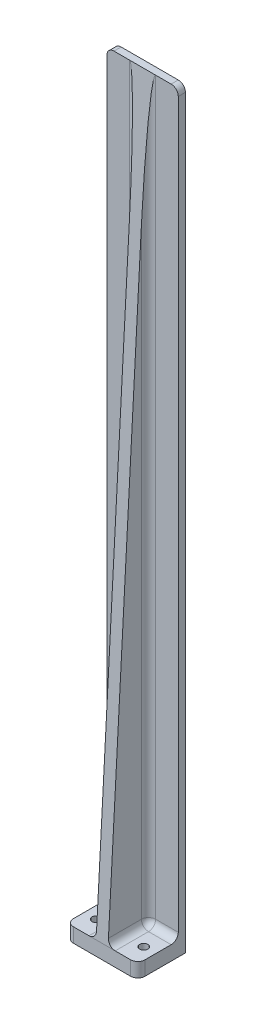
from build123d import *

# Parameters (mm, degrees)
SKETCH_1_W      = 30
SKETCH_1_H      = 20
SKETCH_1_R      = 1.75
EXTRUDE_1_DEPTH = 6
SKETCH_2_W      = 3
SKETCH_2_H      = 310
EXTRUDE_2_DEPTH = 30
EXTRUDE_3_DEPTH = 2.5
FILLET_1_R      = 3


with BuildPart() as part:
    # 草图1 → 凸台-拉伸1 (new body)
    with BuildSketch(Plane(origin=(0, 0, 0), x_dir=(1, 0, 0), z_dir=(0, 1, 0))):
        Rectangle(SKETCH_1_W, SKETCH_1_H)
        with Locations(Location((-10, -2.5, 0), (0, 0, 270))):
            Circle(SKETCH_1_R, mode=Mode.SUBTRACT)
        with Locations(Location((10, -2.5, 0), (0, 0, 90))):
            Circle(SKETCH_1_R, mode=Mode.SUBTRACT)
    extrude(amount=EXTRUDE_1_DEPTH)

    # 草图2 → 凸台-拉伸2 (add)
    with BuildSketch(Plane(origin=(15, 0, 0), x_dir=(0, 0, -1), z_dir=(1, 0, 0))):
        with Locations((8.5, 161)):
            Rectangle(SKETCH_2_W, SKETCH_2_H)
    extrude(amount=-EXTRUDE_2_DEPTH)

    # 草图3 → 凸台-拉伸3 (add, symmetric)
    with BuildSketch(Plane(origin=(0, 0, 0), x_dir=(0, 0, -1), z_dir=(1, 0, 0))):
        Polygon((7, 316), (-10, 6), (7, 6), align=None)
    extrude(amount=EXTRUDE_3_DEPTH, both=True)

    # 圆角1
    # the kernel refuses this fillet: 3 mm, written as the material it adds along each edge
    with BuildSketch(Plane(origin=(-5.5, 9, -4), x_dir=(0, -1, 0), z_dir=(0, 0, -1))) as fillet_1_piece_1_section:
        Polygon((0, 0), (FILLET_1_R, 0), (FILLET_1_R, -FILLET_1_R), (0, -FILLET_1_R), align=None)
    fillet_1_piece_1 = extrude(amount=FILLET_1_R, mode=Mode.PRIVATE)
    fillet_1_piece_1 = fillet_1_piece_1 - Plane(origin=(-5.5, 9, -4), x_dir=(-0.7071067811865475, 0.7071067811865475, 0), z_dir=(0, 0, -1)) * Sphere(FILLET_1_R, mode=Mode.PRIVATE)
    add(fillet_1_piece_1)
    with BuildSketch(Plane(origin=(5.5, 9, -4), x_dir=(0, -1, 0), z_dir=(0, 0, -1))) as fillet_1_piece_2_section:
        Polygon((0, 0), (FILLET_1_R, 0), (FILLET_1_R, FILLET_1_R), (0, FILLET_1_R), align=None)
    fillet_1_piece_2 = extrude(amount=FILLET_1_R, mode=Mode.PRIVATE)
    fillet_1_piece_2 = fillet_1_piece_2 - Plane(origin=(5.5, 9, -4), x_dir=(0.7071067811865475, 0.7071067811865475, 0), z_dir=(0, 0, -1)) * Sphere(FILLET_1_R, mode=Mode.PRIVATE)
    add(fillet_1_piece_2)
    with BuildSketch(Plane(origin=(-5.5, 6, -7), x_dir=(0, 0, 1), z_dir=(-1, 0, 0)), Plane(origin=(15, 6, -7), x_dir=(0, 0, 1), z_dir=(-1, 0, 0))) as fillet_1_piece_3:
        with BuildLine():
            CenterArc((FILLET_1_R, FILLET_1_R), FILLET_1_R, 180, 90)
            Line((0, FILLET_1_R), (0, 0))
            Line((0, 0), (FILLET_1_R, 0))
        make_face()
    extrude(amount=9.5)
    with BuildSketch(Plane(origin=(-2.5, 9, -7), x_dir=(-1, 0, 0), z_dir=(0, 1, 0))) as fillet_1_piece_4_section:
        with BuildLine():
            CenterArc((FILLET_1_R, FILLET_1_R), FILLET_1_R, 180, 90)
            Line((0, FILLET_1_R), (0, 0))
            Line((0, 0), (FILLET_1_R, 0))
        make_face()
    fillet_1_piece_4 = extrude(amount=307, mode=Mode.PRIVATE)
    fillet_1_piece_4 = split(fillet_1_piece_4, bisect_by=Plane(origin=(-3.194365112, 156.962181191, 1.721428773), z_dir=(0, -0.054756437403794746, -0.9984997408927277)), keep=Keep.TOP, mode=Mode.PRIVATE)
    add(fillet_1_piece_4)
    with BuildSketch(Plane(origin=(-2.5, 6, 10), x_dir=(-1, 0, 0), z_dir=(0, 0, -1))) as fillet_1_piece_5_section:
        with BuildLine():
            CenterArc((FILLET_1_R, FILLET_1_R), FILLET_1_R, 180, 90)
            Line((0, FILLET_1_R), (0, 0))
            Line((0, 0), (FILLET_1_R, 0))
        make_face()
    fillet_1_piece_5 = extrude(amount=14, mode=Mode.PRIVATE)
    fillet_1_piece_5 = split(fillet_1_piece_5, bisect_by=Plane(origin=(-3.180148424, 7.059257164, 9.941911704), z_dir=(0, -0.054756437403794746, -0.9984997408927277)), keep=Keep.TOP, mode=Mode.PRIVATE)
    add(fillet_1_piece_5)
    with BuildSketch(Plane(origin=(2.5, 9, -7), x_dir=(1, 0, 0), z_dir=(0, 1, 0))) as fillet_1_piece_6_section:
        with BuildLine():
            CenterArc((FILLET_1_R, -FILLET_1_R), FILLET_1_R, 90, 90)
            Line((0, -FILLET_1_R), (0, 0))
            Line((0, 0), (FILLET_1_R, 0))
        make_face()
    fillet_1_piece_6 = extrude(amount=307, mode=Mode.PRIVATE)
    fillet_1_piece_6 = split(fillet_1_piece_6, bisect_by=Plane(origin=(3.194365112, 156.962181191, 1.721428773), z_dir=(0, -0.054756437403794746, -0.9984997408927277)), keep=Keep.TOP, mode=Mode.PRIVATE)
    add(fillet_1_piece_6)
    with BuildSketch(Plane(origin=(2.5, 6, 10), x_dir=(1, 0, 0), z_dir=(0, 0, -1))) as fillet_1_piece_7_section:
        with BuildLine():
            CenterArc((FILLET_1_R, -FILLET_1_R), FILLET_1_R, 90, 90)
            Line((0, -FILLET_1_R), (0, 0))
            Line((0, 0), (FILLET_1_R, 0))
        make_face()
    fillet_1_piece_7 = extrude(amount=14, mode=Mode.PRIVATE)
    fillet_1_piece_7 = split(fillet_1_piece_7, bisect_by=Plane(origin=(3.180148424, 7.059257164, 9.941911704), z_dir=(0, -0.054756437403794746, -0.9984997408927277)), keep=Keep.TOP, mode=Mode.PRIVATE)
    add(fillet_1_piece_7)
    # the kernel refuses this fillet: 3 mm, written as the material it takes off along each edge
    with BuildSketch(Plane(origin=(-15, 316, 0.5), x_dir=(1, 0, 0), z_dir=(0, 0, -1))) as fillet_1_2_piece_1:
        with BuildLine():
            CenterArc((FILLET_1_R, FILLET_1_R), FILLET_1_R, 180, 90)
            Line((0, FILLET_1_R), (0, 0))
            Line((0, 0), (FILLET_1_R, 0))
        make_face()
    extrude(amount=18, mode=Mode.SUBTRACT)
    with BuildSketch(Plane(origin=(15, 316, 0.5), x_dir=(-1, 0, 0), z_dir=(0, 0, -1))) as fillet_1_2_piece_2:
        with BuildLine():
            CenterArc((FILLET_1_R, -FILLET_1_R), FILLET_1_R, 90, 90)
            Line((0, -FILLET_1_R), (0, 0))
            Line((0, 0), (FILLET_1_R, 0))
        make_face()
    extrude(amount=18, mode=Mode.SUBTRACT)
    with BuildSketch(Plane(origin=(15, -7.5, 10), x_dir=(-1, 0, 0), z_dir=(0, 1, 0))) as fillet_1_2_piece_3:
        with BuildLine():
            CenterArc((FILLET_1_R, -FILLET_1_R), FILLET_1_R, 90, 90)
            Line((0, -FILLET_1_R), (0, 0))
            Line((0, 0), (FILLET_1_R, 0))
        make_face()
    extrude(amount=21, mode=Mode.SUBTRACT)
    with BuildSketch(Plane(origin=(-15, -7.5, 10), x_dir=(1, 0, 0), z_dir=(0, 1, 0))) as fillet_1_2_piece_4:
        with BuildLine():
            CenterArc((FILLET_1_R, FILLET_1_R), FILLET_1_R, 180, 90)
            Line((0, FILLET_1_R), (0, 0))
            Line((0, 0), (FILLET_1_R, 0))
        make_face()
    extrude(amount=21, mode=Mode.SUBTRACT)


solid = part.part
